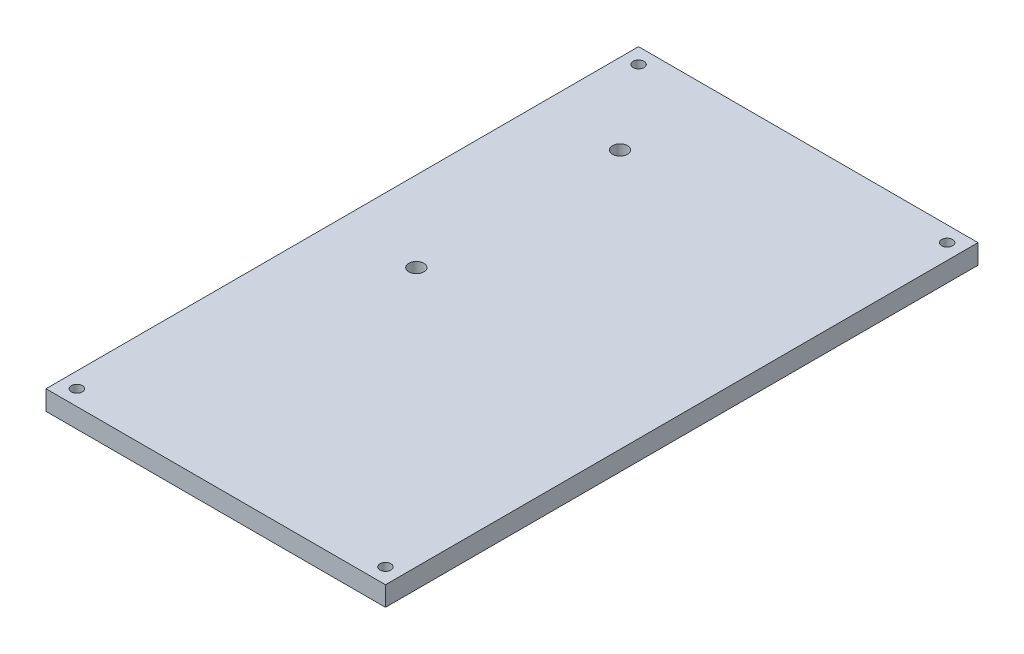
from build123d import *

# Parameters (mm, degrees)
SKETCH2_W             = 55
SKETCH2_H             = 96
BOSS_EXTRUDE1_DEPTH   = 3.175
F_2_CLEARANCE_HOLE1_D = 2.4384
F_0_CLEARANCE_HOLE1_D = 1.778


with BuildPart() as part:
    # Sketch2 → Boss-Extrude1 (new body)
    with BuildSketch(Plane(origin=(0, 0, 0), x_dir=(1, 0, 0), z_dir=(0, 1, 0))):
        with Locations((27.5, 48)):
            Rectangle(SKETCH2_W, SKETCH2_H)
    extrude(amount=BOSS_EXTRUDE1_DEPTH)

    # #2 Clearance Hole1 (through all)
    with Locations(Plane(origin=(0, 3.175, 0), x_dir=(1, 0, 0), z_dir=(0, 1, 0))):
        with Locations((13, 80), (13, 47)):
            Hole(F_2_CLEARANCE_HOLE1_D / 2)

    # #0 Clearance Hole1 (through all)
    with Locations(Plane(origin=(0, 3.175, 0), x_dir=(1, 0, 0), z_dir=(0, 1, 0))):
        with Locations((2.5, 2.5), (52.5, 2.5), (52.5, 93.5), (2.5, 93.5)):
            Hole(F_0_CLEARANCE_HOLE1_D / 2)


solid = part.part
